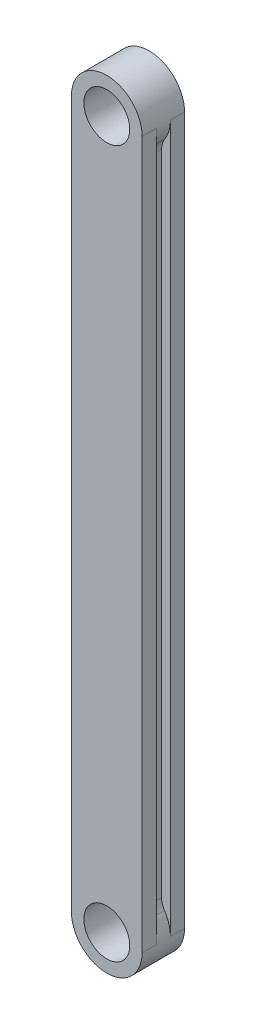
from build123d import *
from build123d.topology import SkipClean

# Parameters (mm, degrees)
BOSS_EXTRUDE1_DEPTH = 400
BOSS_EXTRUDE2_REACH = 403.218
SKETCH2_R           = 20
FILLET1_R           = 10
CUT_EXTRUDE1_REACH  = 423.16
SKETCH3_R           = 13


with BuildPart() as part:
    # Sketch1 → Boss-Extrude1 (new body)
    with BuildSketch(Plane(origin=(0, 0, 0), x_dir=(1, 0, 0), z_dir=(0, 1, 0))):
        Polygon((-20, 12), (20, 12), (20, 4), (15, 4), (15, -4), (20, -4), (20, -12), (-20, -12), (-20, -4), (-15, -4), (-15, 4), (-20, 4), align=None)
    extrude(amount=BOSS_EXTRUDE1_DEPTH)

    # Boss-Extrude2: up to this face of the body (flat: up to its plane)
    boss_extrude2_end = Plane(part.part.faces().sort_by_distance((0, 200, 12))[0])
    # Sketch2 → Boss-Extrude2 (add, up to the picked face)
    with BuildSketch(Plane(origin=(0, 0, -12), x_dir=(-1, 0, 0), z_dir=(0, 0, -1)), mode=Mode.PRIVATE) as boss_extrude2_sk1:
        Circle(SKETCH2_R)
    boss_extrude2_tool1 = split(extrude(boss_extrude2_sk1.sketch, amount=-BOSS_EXTRUDE2_REACH, mode=Mode.PRIVATE), bisect_by=boss_extrude2_end, keep=Keep.BOTH, mode=Mode.PRIVATE)
    boss_extrude2 = boss_extrude2_tool1.solids().sort_by(Axis((0, 0, -12), (0, 0, 1)))[0]
    add(boss_extrude2)

    # Mirror1: Boss-Extrude2 across plane
    with SkipClean():  # the faces are left unmerged after this step: merging them gives an invalid solid
        add(boss_extrude2.mirror(Plane.ZX.offset(200)))
    add(part.part.scale(1), mode=Mode.REPLACE)  # the faces are merged on a copy

    # Fillet1
    fillet1_edges = [part.edges().sort_by_distance(p)[0] for p in [
        (15, 13.228756555, 0),
        (-15, 13.228756555, 0),
        (-15, 386.771243445, 0),
        (15, 386.771243445, 0),
    ]]
    fillet(fillet1_edges, radius=FILLET1_R)

    # Sketch3 → Cut-Extrude1 (cut, up to next)
    with BuildSketch(Plane(origin=(0, 0, -12), x_dir=(-1, 0, 0), z_dir=(0, 0, -1)), mode=Mode.PRIVATE) as cut_extrude1_sk1:
        with Locations((0, 400)):
            Circle(SKETCH3_R)
    cut_extrude1_tool1 = extrude(cut_extrude1_sk1.sketch, amount=-CUT_EXTRUDE1_REACH, mode=Mode.PRIVATE) & part.part
    cut_extrude1 = cut_extrude1_tool1.solids().sort_by_distance((0, 400, -12))[0]
    add(cut_extrude1, mode=Mode.SUBTRACT)

    # Mirror2: Cut-Extrude1 across plane
    add(cut_extrude1.mirror(Plane.ZX.offset(200)), mode=Mode.SUBTRACT)


solid = part.part
